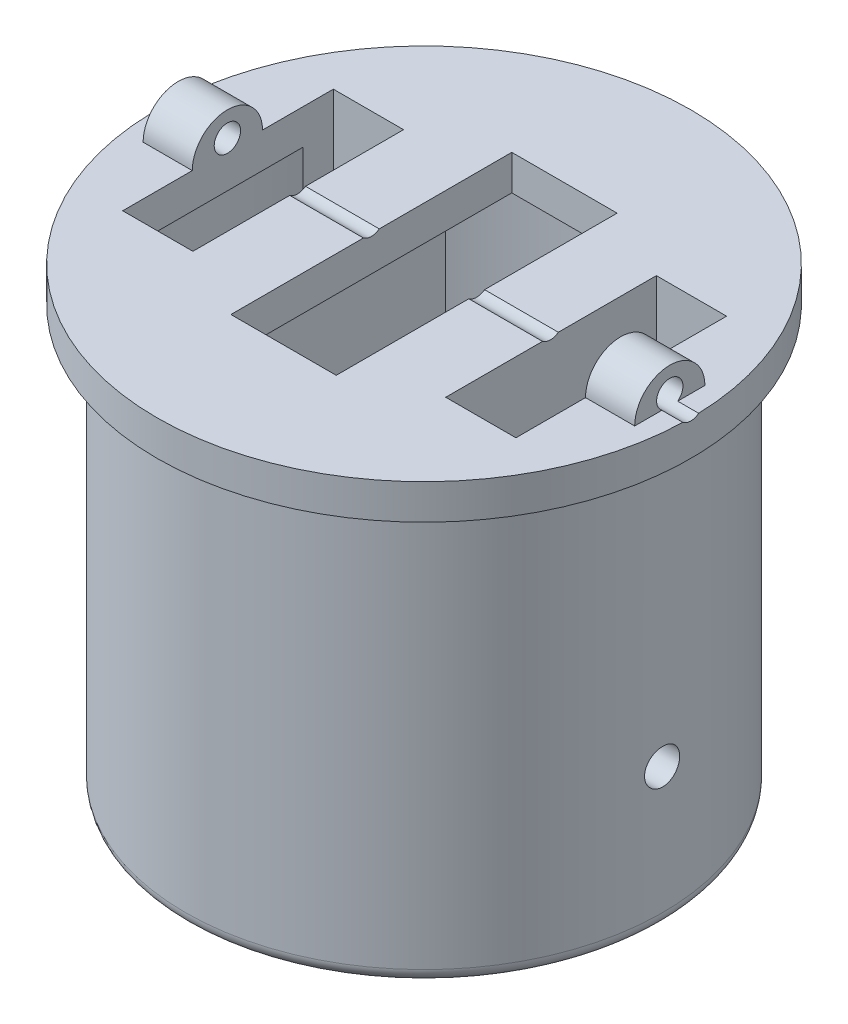
from build123d import *

# Parameters (mm, degrees)
SKETCH1_R               = 43.18
SKETCH1_R_2             = 38.1
BOSS_EXTRUDE1_DEPTH     = 76.2
SKETCH4_R               = 48.26
BOSS_EXTRUDE2_DEPTH     = 6.35
SKETCH5_W               = 19.05
SKETCH5_H               = 50.8
CUT_EXTRUDE2_DEPTH      = 6.35
BOSS_EXTRUDE3_DEPTH     = 8.89
CUT_EXTRUDE3_START      = -12.7
SKETCH7_R               = 2.38125
CUT_EXTRUDE3_DEPTH      = 99.06
CUT_EXTRUDE4_DEPTH      = 48.26
CUT_EXTRUDE4_DEPTH_BACK = 48.26
SKETCH8_R               = 3.175
FILLET2_R               = 2.54
SKETCH11_W              = 12.7
SKETCH11_H              = 38.1
CUT_EXTRUDE5_DEPTH      = 69.85
BOSS_EXTRUDE4_DEPTH     = 44.45


with BuildPart() as part:
    # Sketch1 → Boss-Extrude1 (new body)
    with BuildSketch(Plane(origin=(0, 0, 0), x_dir=(1, 0, 0), z_dir=(0, 1, 0))):
        Circle(SKETCH1_R)
        Circle(SKETCH1_R_2, mode=Mode.SUBTRACT)
    extrude(amount=BOSS_EXTRUDE1_DEPTH)

    # Sketch4 → Boss-Extrude2 (add)
    with BuildSketch(Plane(origin=(0, 76.2, 0), x_dir=(1, 0, 0), z_dir=(0, 1, 0))):
        Circle(SKETCH4_R)
    extrude(amount=BOSS_EXTRUDE2_DEPTH)

    # Sketch5 → Cut-Extrude2 (cut)
    with BuildSketch(Plane(origin=(0, 82.55, 0), x_dir=(1, 0, 0), z_dir=(0, 1, 0))):
        Rectangle(SKETCH5_W, SKETCH5_H)
    extrude(amount=-CUT_EXTRUDE2_DEPTH, mode=Mode.SUBTRACT)

    # Sketch6 → Boss-Extrude3 (add)
    with BuildSketch(Plane(origin=(35.56, 0, 0), x_dir=(0, 0, -1), z_dir=(1, 0, 0))):
        with BuildLine():
            Line((-6.35, 82.55), (6.35, 82.55))
            ThreePointArc((6.35, 82.55), (0, 88.9), (-6.35, 82.55))
        make_face()
    boss_extrude3 = extrude(amount=BOSS_EXTRUDE3_DEPTH)

    # Sketch7 → Cut-Extrude3 (cut)
    with BuildSketch(Plane.ZY.offset(-35.56).offset(CUT_EXTRUDE3_START)):
        with Locations((0, 84.455)):
            Circle(SKETCH7_R)
    cut_extrude3 = extrude(amount=CUT_EXTRUDE3_DEPTH, mode=Mode.SUBTRACT)

    # Mirror1: Boss-Extrude3, Cut-Extrude3 across plane
    add(boss_extrude3.mirror(Plane(origin=(0, 0, 0), x_dir=(0, 0, 1), z_dir=(1, 0, 0))))
    add(cut_extrude3.mirror(Plane(origin=(0, 0, 0), x_dir=(0, 0, 1), z_dir=(1, 0, 0))), mode=Mode.SUBTRACT)

    # Sketch8 → Cut-Extrude4 (cut, two sides: drawn at the far end of the back side and taken through both)
    with BuildSketch(Plane(origin=(0, 0, 0), x_dir=(0, 0, -1), z_dir=(1, 0, 0)).offset(-CUT_EXTRUDE4_DEPTH_BACK)):
        with Locations((0, 25.4)):
            Circle(SKETCH8_R)
    extrude(amount=CUT_EXTRUDE4_DEPTH + CUT_EXTRUDE4_DEPTH_BACK, mode=Mode.SUBTRACT)

    # Fillet2
    fillet2_edges = [part.edges().sort_by_distance(p)[0] for p in [
        (-43.18, 0, 0),
    ]]
    fillet(fillet2_edges, radius=FILLET2_R)

    # Sketch11 → Cut-Extrude5 (cut)
    with BuildSketch(Plane(origin=(0, 82.55, 0), x_dir=(1, 0, 0), z_dir=(0, 1, 0))):
        with Locations((29.21, 0.11160914)):
            Rectangle(SKETCH11_W, SKETCH11_H)
        with Locations((-29.21, 0.11160914)):
            Rectangle(SKETCH11_W, SKETCH11_H)
    extrude(amount=-CUT_EXTRUDE5_DEPTH, mode=Mode.SUBTRACT)

    # Sketch12 → Boss-Extrude4 (add)
    with BuildSketch(Plane.XZ.offset(-76.2)):
        Polygon((-19.05, 22.74839086), (-31.75, 22.74839086), (-33.059754259, 18.93839086), (-22.86, 18.93839086), (-22.86, -19.16160914), (-32.930878141, -19.16160914), (-31.75, -22.97160914), (-19.05, -22.97160914), align=None)
        Polygon((22.86, 18.93839086), (22.86, -19.16160914), (32.930878141, -19.16160914), (31.75, -22.97160914), (19.05, -22.97160914), (19.05, 22.74839086), (31.75, 22.74839086), (33.059754259, 18.93839086), align=None)
    extrude(amount=BOSS_EXTRUDE4_DEPTH)


solid = part.part
